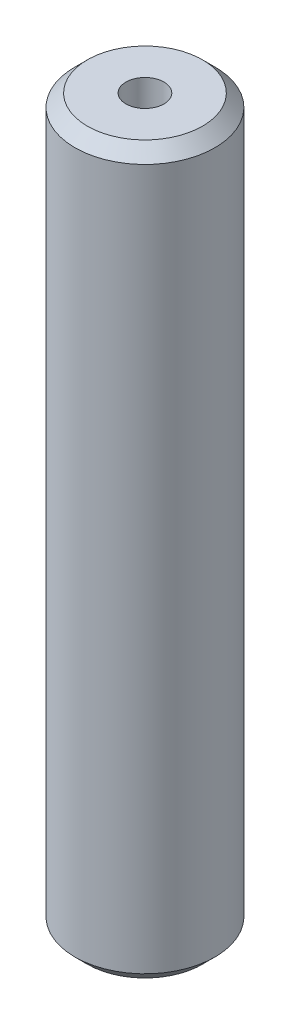
from build123d import *

# Parameters (mm, degrees)
SKETCH1_R           = 10
BOSS_EXTRUDE1_DEPTH = 103.705596923
SKETCH2_R           = 2.715590905
CUT_EXTRUDE1_DEPTH  = 105.665423294
CHAMFER1_SIZE       = 1.777253917


with BuildPart() as part:
    # Sketch1 → Boss-Extrude1 (new body)
    with BuildSketch(Plane(origin=(0, 0, 0), x_dir=(1, 0, 0), z_dir=(0, 1, 0))):
        Circle(SKETCH1_R)
    extrude(amount=BOSS_EXTRUDE1_DEPTH)

    # Sketch2 → Cut-Extrude1 (cut, through all)
    with BuildSketch(Plane(origin=(0, 0, 0), x_dir=(1, 0, 0), z_dir=(0, 1, 0))):
        Circle(SKETCH2_R)
    extrude(amount=CUT_EXTRUDE1_DEPTH, mode=Mode.SUBTRACT)

    # Chamfer1
    chamfer1_edges = [part.edges().sort_by_distance(p)[0] for p in [
        (-10, 103.705596923, 0),
        (-10, 0, 0),
    ]]
    chamfer(chamfer1_edges, length=CHAMFER1_SIZE)


solid = part.part
